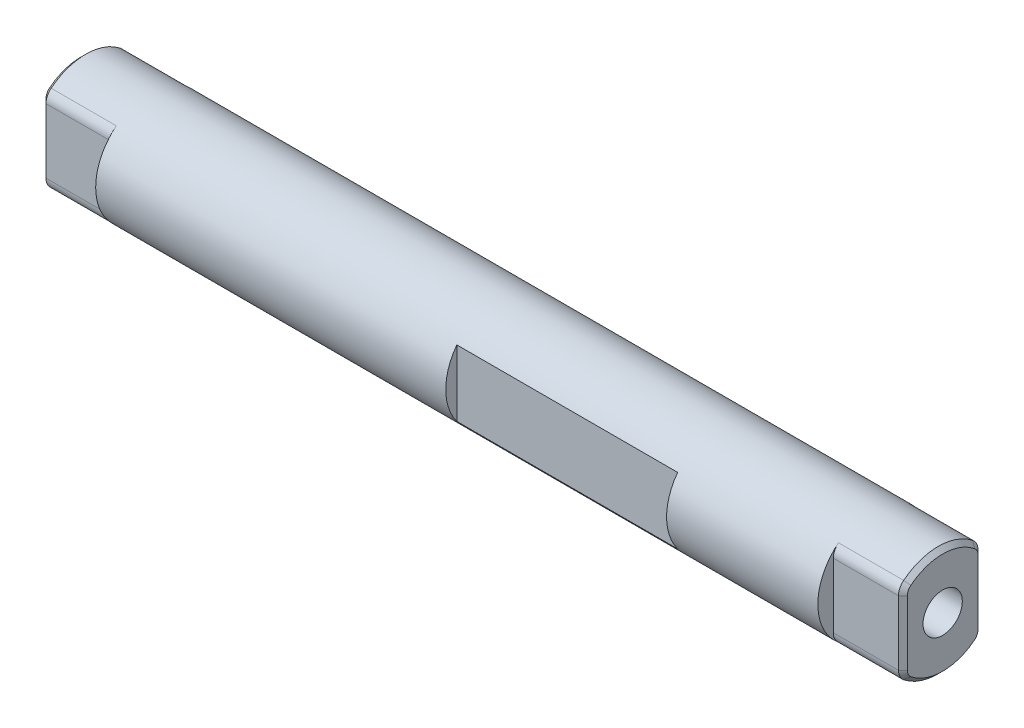
from build123d import *

# Parameters (mm, degrees)
SKETCH1_R                = 3.175
BOSS_EXTRUDE1_DEPTH      = 20.7645
BOSS_EXTRUDE2_START      = 4.0005
BOSS_EXTRUDE2_DEPTH      = 4.0005
FILLET1_R                = 0.79375
CHAMFER1_SIZE            = 0.254
FILLET1_OF_MIRROR2_R     = 0.79375
CHAMFER1_OF_MIRROR2_SIZE = 0.254
SKETCH5_W                = 12.7
SKETCH5_H                = 6.35
CUT_EXTRUDE1_DEPTH       = 0.635


with BuildPart() as part:
    # Sketch1 → Boss-Extrude1 (new, symmetric)
    with BuildSketch(Plane(origin=(0, 0, 0), x_dir=(0, 0, -1), z_dir=(1, 0, 0))):
        Circle(SKETCH1_R)
    extrude(amount=BOSS_EXTRUDE1_DEPTH, both=True)

    # Sketch2 → Boss-Extrude2 (add)
    with BuildSketch(Plane(origin=(20.7645, 0, 0), x_dir=(0, 0, -1), z_dir=(1, 0, 0)).offset(BOSS_EXTRUDE2_START)):
        with BuildLine():
            Line((-2.286, 2.20336765), (-2.286, -2.20336765))
            ThreePointArc((-2.286, -2.20336765), (0, -3.175), (2.286, -2.20336765))
            Line((2.286, -2.20336765), (2.286, 2.20336765))
            ThreePointArc((2.286, 2.20336765), (0, 3.175), (-2.286, 2.20336765))
        make_face()
    boss_extrude2 = extrude(amount=-BOSS_EXTRUDE2_DEPTH)

    # Fillet1
    # the kernel refuses this fillet: 0.79375 mm, written as the material it takes off along each edge
    with BuildSketch(Plane(origin=(25.768693051, 2.20336765, -2.286), x_dir=(0, 0.6746831627986616, 0.7381074649642793), z_dir=(-1, 0, 0)), Plane(origin=(25.768693051, -2.20336765, 2.286), x_dir=(0, -0.6746831627986605, -0.7381074649642803), z_dir=(-1, 0, 0))) as fillet1_piece_1:
        with BuildLine():
            CenterArc((0.351292568, -0.792161955), FILLET1_R, 86.375070371, 51.195378821)
            Line((-0.234580233, -0.256632195), (0, 0))
            ThreePointArc((0, 0), (0.20073861, 0.006352179), (0.40147722, 0))
        make_face()
    extrude(amount=5.004193051, mode=Mode.SUBTRACT)
    with BuildSketch(Plane(origin=(25.768693051, -2.20336765, -2.286), x_dir=(0, -0.6746831627986618, 0.738107464964279), z_dir=(-1, 0, 0)), Plane(origin=(25.768693051, 2.20336765, 2.286), x_dir=(0, 0.6746831627986606, -0.73810746496428), z_dir=(-1, 0, 0))) as fillet1_piece_2:
        with BuildLine():
            CenterArc((0.351292568, 0.792161955), FILLET1_R, 222.429550808, 51.195378821)
            Line((-0.234580233, 0.256632195), (0, 0))
            ThreePointArc((0, 0), (0.20073861, -0.006352179), (0.40147722, 0))
        make_face()
    extrude(amount=5.004193051, mode=Mode.SUBTRACT)

    # Sketch3 → #4-40 Tapped Hole1 (revolve, cut)
    with BuildSketch(Plane(origin=(24.765, 0, 0), x_dir=(0, 0, -1), z_dir=(0, 1, 0))):
        Polygon((0, 0), (0, 8.299152758), (1.1303, 7.62), (1.1303, 0), align=None)
    f_4_40_tapped_hole1 = revolve(axis=Axis((31.115, 0, 0), (-1, 0, 0)), mode=Mode.SUBTRACT)

    # Chamfer1
    chamfer1_edges = [part.edges().sort_by_distance(p)[0] for p in [
        (24.765, 0, -2.286),
        (24.765, 3.175, 0),
        (24.765, -3.175, 0),
        (24.765, 0, 2.286),
        (24.765, 2.198617373, 2.208093398),
        (24.765, -2.198617373, 2.208093398),
        (24.765, 2.198617373, -2.208093398),
        (24.765, -2.198617373, -2.208093398),
    ]]
    chamfer(chamfer1_edges, length=CHAMFER1_SIZE)

    # Mirror2: Boss-Extrude2, #4-40 Tapped Hole1 across plane
    add(boss_extrude2.mirror(Plane(origin=(0, 0, 0), x_dir=(0, 0, 1), z_dir=(1, 0, 0))))
    add(f_4_40_tapped_hole1.mirror(Plane(origin=(0, 0, 0), x_dir=(0, 0, 1), z_dir=(1, 0, 0))), mode=Mode.SUBTRACT)

    # Fillet1 of Mirror2
    # the kernel refuses this fillet: 0.79375 mm, written as the material it takes off along each edge
    with BuildSketch(Plane(origin=(-25.768693051, 2.20336765, -2.286), x_dir=(0, 0.6746831627986613, 0.7381074649642795), z_dir=(1, 0, 0)), Plane(origin=(-25.768693051, -2.20336765, 2.286), x_dir=(0, -0.67468316279866, -0.7381074649642806), z_dir=(1, 0, 0))) as fillet1_of_mirror2_piece_1:
        with BuildLine():
            CenterArc((0.351292568, 0.792161955), FILLET1_OF_MIRROR2_R, 222.429550808, 51.195378821)
            Line((-0.234580233, 0.256632195), (0, 0))
            ThreePointArc((0, 0), (0.20073861, -0.006352179), (0.40147722, 0))
        make_face()
    extrude(amount=5.004193051, mode=Mode.SUBTRACT)
    with BuildSketch(Plane(origin=(-25.768693051, -2.20336765, -2.286), x_dir=(0, -0.6746831627986595, 0.738107464964281), z_dir=(1, 0, 0)), Plane(origin=(-25.768693051, 2.20336765, 2.286), x_dir=(0, 0.674683162798661, -0.7381074649642797), z_dir=(1, 0, 0))) as fillet1_of_mirror2_piece_2:
        with BuildLine():
            CenterArc((0.351292568, -0.792161955), FILLET1_OF_MIRROR2_R, 86.375070371, 51.195378821)
            Line((-0.234580233, -0.256632195), (0, 0))
            ThreePointArc((0, 0), (0.20073861, 0.006352179), (0.40147722, 0))
        make_face()
    extrude(amount=5.004193051, mode=Mode.SUBTRACT)

    # Chamfer1 of Mirror2
    chamfer1_of_mirror2_edges = [part.edges().sort_by_distance(p)[0] for p in [
        (-24.765, 0, -2.286),
        (-24.765, 3.175, 0),
        (-24.765, -3.175, 0),
        (-24.765, 0, 2.286),
        (-24.765, 2.198617373, 2.208093398),
        (-24.765, -2.198617373, 2.208093398),
        (-24.765, 2.198617373, -2.208093398),
        (-24.765, -2.198617373, -2.208093398),
    ]]
    chamfer(chamfer1_of_mirror2_edges, length=CHAMFER1_OF_MIRROR2_SIZE)

    # Sketch5 → Cut-Extrude1 (cut)
    with BuildSketch(Plane.XY.offset(3.175)):
        with Locations((5.715, 0)):
            Rectangle(SKETCH5_W, SKETCH5_H)
    extrude(amount=-CUT_EXTRUDE1_DEPTH, mode=Mode.SUBTRACT)


solid = part.part
